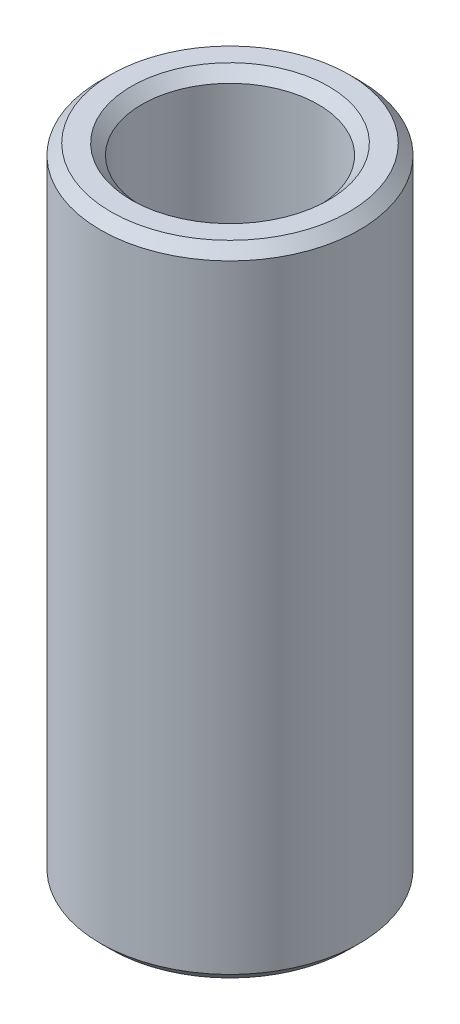
from build123d import *

# Parameters (mm, degrees)
SKETCH1_R           = 30
BOSS_EXTRUDE1_DEPTH = 148.031641057
SKETCH2_R           = 20.421476917
CUT_EXTRUDE1_DEPTH  = 154.991450263
CHAMFER1_SIZE       = 2.422746461


with BuildPart() as part:
    # Sketch1 → Boss-Extrude1 (new body)
    with BuildSketch(Plane(origin=(0, 0, 0), x_dir=(1, 0, 0), z_dir=(0, 1, 0))):
        Circle(SKETCH1_R)
    extrude(amount=BOSS_EXTRUDE1_DEPTH)

    # Sketch2 → Cut-Extrude1 (cut, through all)
    with BuildSketch(Plane(origin=(0, 0, 0), x_dir=(1, 0, 0), z_dir=(0, 1, 0))):
        Circle(SKETCH2_R)
    extrude(amount=CUT_EXTRUDE1_DEPTH, mode=Mode.SUBTRACT)

    # Chamfer1
    chamfer1_edges = [part.edges().sort_by_distance(p)[0] for p in [
        (-20.421476917, 148.031641057, 0),
        (-20.421476917, 0, 0),
        (-30, 0, 0),
        (-30, 148.031641057, 0),
    ]]
    chamfer(chamfer1_edges, length=CHAMFER1_SIZE)


solid = part.part
